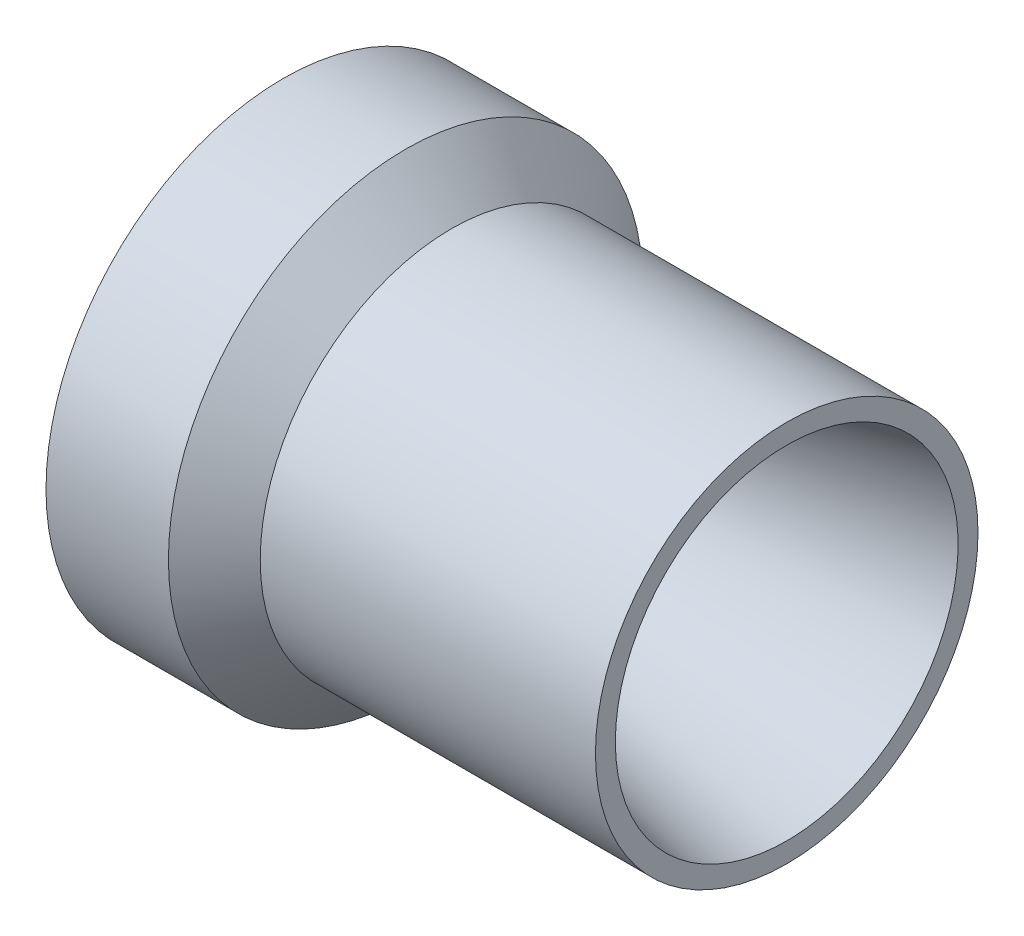
from build123d import *


with BuildPart() as part:
    # Sketch1 → Revolve1 (revolve)
    with BuildSketch(Plane.XY):
        Polygon((104.479711473, 19.05), (104.479711473, 23.1775), (20.831388127, 40.9575), (14.481388127, 40.9575), (0, 15.875), (0, 9.525), (25.4, 9.525), (34.925, 19.05), align=None)
    revolve(axis=Axis((0, 58.7375, 0), (1, 0, 0)))


solid = part.part
